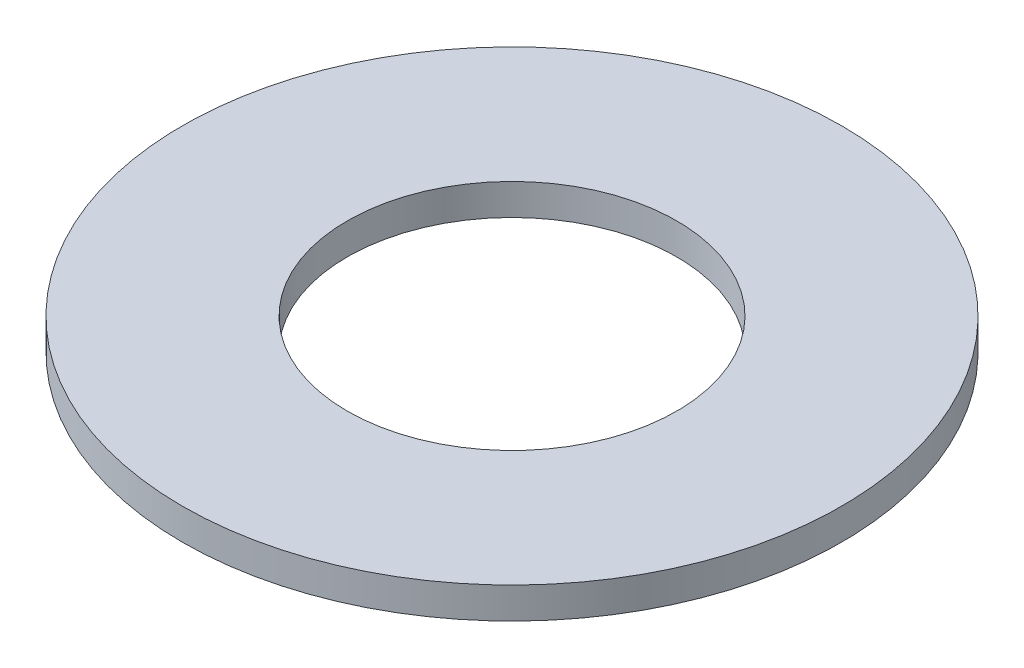
from build123d import *

# Parameters (mm, degrees)
SKETCH1_R           = 95
BOSS_EXTRUDE1_DEPTH = 9
SKETCH2_R           = 47.5
CUT_EXTRUDE1_DEPTH  = 135.651401775


with BuildPart() as part:
    # Sketch1 → Boss-Extrude1 (new body)
    with BuildSketch(Plane(origin=(0, 0, 0), x_dir=(1, 0, 0), z_dir=(0, 1, 0))):
        Circle(SKETCH1_R)
    extrude(amount=BOSS_EXTRUDE1_DEPTH)

    # Sketch2 → Cut-Extrude1 (cut, through all)
    with BuildSketch(Plane(origin=(0, 0, 0), x_dir=(1, 0, 0), z_dir=(0, 1, 0))):
        Circle(SKETCH2_R)
    extrude(amount=CUT_EXTRUDE1_DEPTH, mode=Mode.SUBTRACT)


solid = part.part
